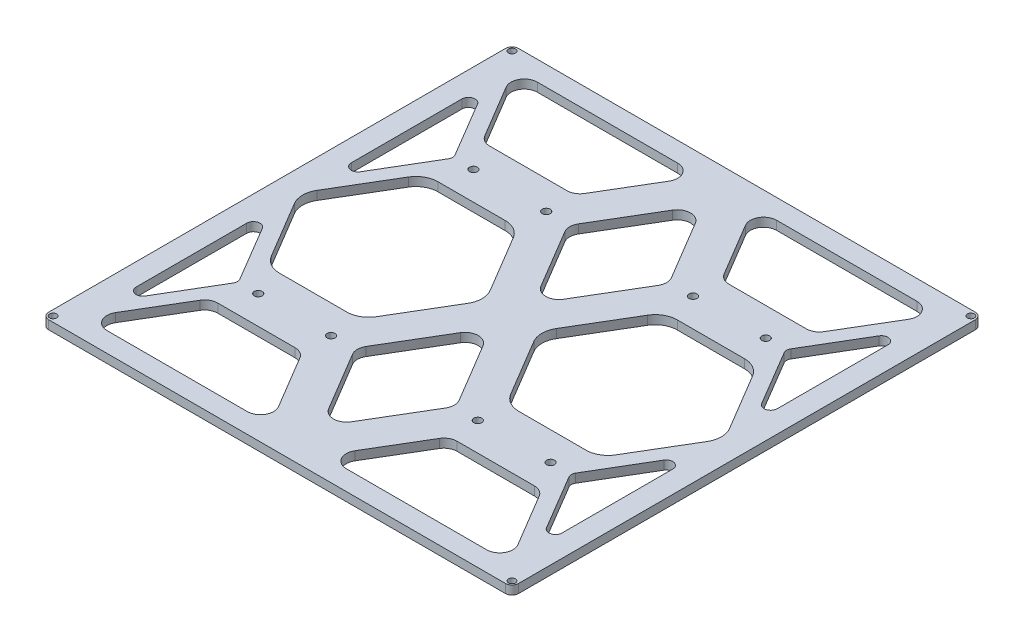
from build123d import *

# Parameters (mm, degrees)
SKETCH_1_W          = 214
SKETCH_1_H          = 214
EXTRUDE_1_DEPTH     = 4
FILLET_1_R          = 3
SKETCH_2_R          = 1.6
SKETCH_2_R_2        = 1.8
CUT_EXTRUDE_1_DEPTH = 152.373709739
CUT_EXTRUDE_2_DEPTH = 152.373709739
FILLET_2_R          = 10
FILLET_3_R          = 6
FILLET_4_R          = 3
FILLET_5_R          = 6


with BuildPart() as part:
    # 스케치1 → 보스-돌출1 (new body)
    with BuildSketch(Plane(origin=(0, 0, 0), x_dir=(1, 0, 0), z_dir=(0, 1, 0))):
        Rectangle(SKETCH_1_W, SKETCH_1_H)
    extrude(amount=EXTRUDE_1_DEPTH)

    # 필렛1
    fillet_1_edges = [part.edges().sort_by_distance(p)[0] for p in [
        (107, 2, -107),
        (107, 2, 107),
        (-107, 2, 107),
        (-107, 2, -107),
    ]]
    fillet(fillet_1_edges, radius=FILLET_1_R)

    # 스케치2 → 컷-돌출1 (cut, through all)
    with BuildSketch(Plane(origin=(0, 4, 0), x_dir=(1, 0, 0), z_dir=(0, 1, 0))):
        with Locations((-104.5, 104.5)):
            Circle(SKETCH_2_R)
        with Locations((104.5, -104.5)):
            Circle(SKETCH_2_R)
        with Locations((-104.5, -104.5)):
            Circle(SKETCH_2_R)
        with Locations((104.5, 104.5)):
            Circle(SKETCH_2_R)
        with Locations((-66.575, 49)):
            Circle(SKETCH_2_R_2)
        with Locations((66.575, 49)):
            Circle(SKETCH_2_R_2)
        with Locations((-66.575, -49)):
            Circle(SKETCH_2_R_2)
        with Locations((66.575, -49)):
            Circle(SKETCH_2_R_2)
        with Locations((-33.425, 49)):
            Circle(SKETCH_2_R_2)
        with Locations((33.425, 49)):
            Circle(SKETCH_2_R_2)
        with Locations((-33.425, -49)):
            Circle(SKETCH_2_R_2)
        with Locations((33.425, -49)):
            Circle(SKETCH_2_R_2)
    extrude(amount=-CUT_EXTRUDE_1_DEPTH, mode=Mode.SUBTRACT)

    # 스케치3 → 컷-돌출2 (cut, through all)
    with BuildSketch(Plane(origin=(0, 4, 0), x_dir=(1, 0, 0), z_dir=(0, 1, 0))):
        Polygon((-97, 98), (-12, 98), (-33.5, 61.920227273), (-75.5, 61.920227273), align=None)
        Polygon((97, 98), (12, 98), (33.5, 61.920227273), (75.5, 61.920227273), align=None)
        Polygon((-97, 85.124359856), (-97, 12.875640144), (-75.575, 49), align=None)
        Polygon((97, 85.124359856), (97, 12.875640144), (75.575, 49), align=None)
        Polygon((97, -85.124359856), (97, -12.875640144), (75.575, -49), align=None)
        Polygon((-75.5, -61.920227273), (-97, -98), (-12, -98), (-33.5, -61.920227273), align=None)
        Polygon((-97, -12.875640144), (-75.575, -49), (-97, -85.124359856), align=None)
        Polygon((75.5, -61.920227273), (97, -98), (12, -98), (33.5, -61.920227273), align=None)
        Polygon((-12, 0), (-33.5, 36.079772727), (-75.5, 36.079772727), (-97, 0), (-75.5, -36.079772727), (-33.5, -36.079772727), align=None)
        Polygon((75.5, 36.079772727), (97, 0), (75.5, -36.079772727), (33.5, -36.079772727), (12, 0), (33.5, 36.079772727), align=None)
        Polygon((0, 87), (-23.035714286, 48.34310065), (0, 9.6862013), (23.035714286, 48.34310065), align=None)
        Polygon((-23.035714286, -48.34310065), (0, -9.6862013), (23.035714286, -48.34310065), (0, -87), align=None)
    extrude(amount=-CUT_EXTRUDE_2_DEPTH, mode=Mode.SUBTRACT)

    # 필렛2
    fillet_2_edges = [part.edges().sort_by_distance(p)[0] for p in [
        (-12, 2, 0),
        (-33.5, 2, 36.079772727),
        (-97, 2, 0),
        (-75.5, 2, -36.079772727),
        (-33.5, 2, -36.079772727),
        (75.5, 2, -36.079772727),
        (33.5, 2, -36.079772727),
        (-75.5, 2, 36.079772727),
        (12, 2, 0),
        (33.5, 2, 36.079772727),
        (75.5, 2, 36.079772727),
        (97, 2, 0),
    ]]
    fillet(fillet_2_edges, radius=FILLET_2_R)

    # 필렛3
    fillet_3_edges = [part.edges().sort_by_distance(p)[0] for p in [
        (97, 2, -98),
        (12, 2, -98),
        (-12, 2, -98),
        (-97, 2, -98),
        (75.5, 2, -61.920227273),
        (33.5, 2, -61.920227273),
        (-33.5, 2, -61.920227273),
        (-75.5, 2, -61.920227273),
        (12, 2, 98),
        (97, 2, 98),
        (33.5, 2, 61.920227273),
        (75.5, 2, 61.920227273),
        (-33.5, 2, 61.920227273),
        (-12, 2, 98),
        (-97, 2, 98),
        (-75.5, 2, 61.920227273),
    ]]
    fillet(fillet_3_edges, radius=FILLET_3_R)

    # 필렛4
    fillet_4_edges = [part.edges().sort_by_distance(p)[0] for p in [
        (97, 2, 12.875640144),
        (-97, 2, 12.875640144),
        (75.575, 2, 49),
        (-75.575, 2, 49),
        (-97, 2, 85.124359856),
        (97, 2, 85.124359856),
        (97, 2, -85.124359856),
        (75.575, 2, -49),
        (97, 2, -12.875640144),
        (-97, 2, -85.124359856),
        (-97, 2, -12.875640144),
        (-75.575, 2, -49),
    ]]
    fillet(fillet_4_edges, radius=FILLET_4_R)

    # 필렛5
    fillet_5_edges = [part.edges().sort_by_distance(p)[0] for p in [
        (0, 2, -87),
        (23.035714286, 2, -48.34310065),
        (-23.035714286, 2, -48.34310065),
        (0, 2, -9.6862013),
        (0, 2, 87),
        (-23.035714286, 2, 48.34310065),
        (0, 2, 9.6862013),
        (23.035714286, 2, 48.34310065),
    ]]
    fillet(fillet_5_edges, radius=FILLET_5_R)


solid = part.part
